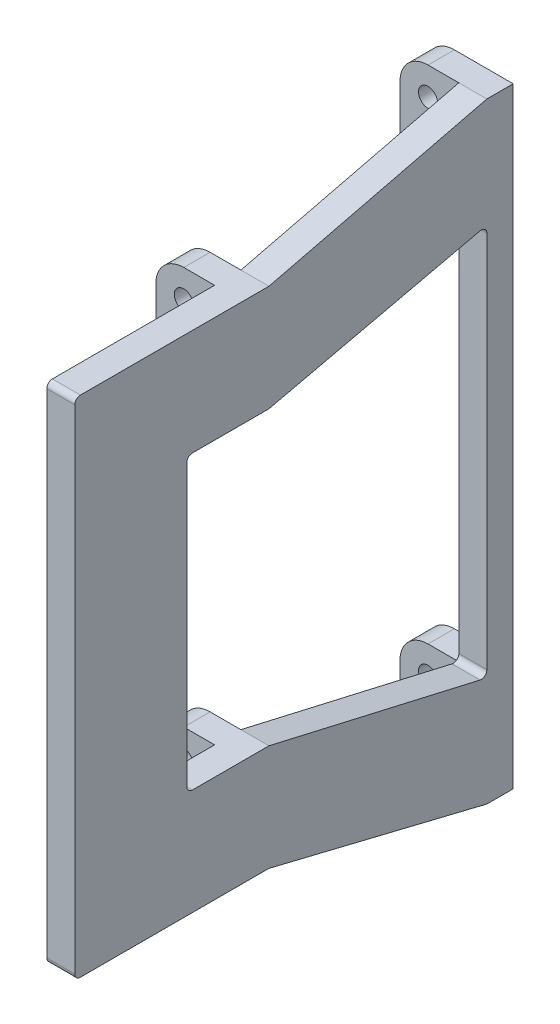
from build123d import *

# Parameters (mm, degrees)
SKETCH_1_W          = 109
SKETCH_1_H          = 78.25
EXTRUDE_1_DEPTH     = 5
CUT_EXTRUDE_1_DEPTH = 5
SKETCH_3_W          = 18.95
SKETCH_3_H          = 4.7
SKETCH_3_W_2        = 19.5
EXTRUDE_2_DEPTH     = 10.5
SKETCH_4_R          = 1.7
CUT_EXTRUDE_2_DEPTH = 5
SKETCH_5_R          = 1.7
CUT_EXTRUDE_3_DEPTH = 5
FILLET_1_R          = 5
FILLET_2_R          = 1
FILLET_3_R          = 1


with BuildPart() as part:
    # 草圖1 → 填料-伸長1 (new body)
    with BuildSketch(Plane.YZ):
        Rectangle(SKETCH_1_W, SKETCH_1_H)
    extrude(amount=EXTRUDE_1_DEPTH)

    # 草圖2 → 除料-伸長1 (cut)
    with BuildSketch(Plane(origin=(0, 0, 0), x_dir=(0, -1, 0), z_dir=(-1, 0, 0))):
        Polygon((-54.5, 39.125), (-54.5, -34.425), (-45, 4.475), (-45, 39.125), align=None)
        Polygon((45, 39.125), (45, 4.475), (54.5, -34.425), (54.5, 39.125), align=None)
        Polygon((-35, -34.425), (35, -34.425), (26.05, 4.475), (26.05, 19.125), (-26.05, 19.125), (-26.05, 4.475), align=None)
    extrude(amount=-CUT_EXTRUDE_1_DEPTH, mode=Mode.SUBTRACT)

    # 草圖3 → 填料-伸長2 (add)
    with BuildSketch(Plane(origin=(0, 0, 0), x_dir=(0, -1, 0), z_dir=(-1, 0, 0))):
        with Locations((-35.525, 6.825)):
            Rectangle(SKETCH_3_W, SKETCH_3_H)
        with Locations((-44.75, -36.775)):
            Rectangle(SKETCH_3_W_2, SKETCH_3_H)
        with Locations((44.75, -36.775)):
            Rectangle(SKETCH_3_W_2, SKETCH_3_H)
        with Locations((35.525, 6.825)):
            Rectangle(SKETCH_3_W, SKETCH_3_H)
    extrude(amount=EXTRUDE_2_DEPTH)

    # 草圖4 → 除料-伸長2 (cut)
    with BuildSketch(Plane(origin=(0, 0, 9.175), x_dir=(0, -1, 0), z_dir=(0, 0, 1))):
        with Locations(Location((-40, -5.5, 0), (0, 0, 90))):
            Circle(SKETCH_4_R)
        with Locations(Location((-31.05, -5.5, 0), (0, 0, 90))):
            Circle(SKETCH_4_R)
        with Locations((31.05, -5.5)):
            Circle(SKETCH_4_R)
        with Locations((40, -5.5)):
            Circle(SKETCH_4_R)
    extrude(amount=-CUT_EXTRUDE_2_DEPTH, mode=Mode.SUBTRACT)

    # 草圖5 → 除料-伸長3 (cut)
    with BuildSketch(Plane(origin=(0, 0, -34.425), x_dir=(0, -1, 0), z_dir=(0, 0, 1))):
        with Locations(Location((-49.5, -5.5, 0), (0, 0, 90))):
            Circle(SKETCH_5_R)
        with Locations(Location((-40, -5.5, 0), (0, 0, 90))):
            Circle(SKETCH_5_R)
        with Locations((40, -5.5)):
            Circle(SKETCH_5_R)
        with Locations(Location((49.5, -5.5, 0), (0, 0, 90))):
            Circle(SKETCH_5_R)
    extrude(amount=-CUT_EXTRUDE_3_DEPTH, mode=Mode.SUBTRACT)

    # 圓角1
    fillet_1_edges = [part.edges().sort_by_distance(p)[0] for p in [
        (-10.5, -45, 6.825),
        (-10.5, -26.05, 6.825),
        (-10.5, -54.5, -36.775),
        (-10.5, -35, -36.775),
        (-10.5, 54.5, -36.775),
        (-10.5, 35, -36.775),
        (-10.5, 45, 6.825),
        (-10.5, 26.05, 6.825),
    ]]
    fillet(fillet_1_edges, radius=FILLET_1_R)

    # 圓角2
    fillet_2_edges = [part.edges().sort_by_distance(p)[0] for p in [
        (2.5, 45, 39.125),
        (2.5, -45, 39.125),
    ]]
    fillet(fillet_2_edges, radius=FILLET_2_R)

    # 圓角3
    # the kernel refuses this fillet: 1 mm, written as the material it adds along each edge
    with BuildSketch(Plane(origin=(0, 35, -34.425), x_dir=(0, -1, 0), z_dir=(1, 0, 0))) as fillet_3_piece_1:
        with BuildLine():
            CenterArc((FILLET_3_R * 1.25620356602, -FILLET_3_R), FILLET_3_R, 90, 102.956961135)
            Line((FILLET_3_R * 0.281664799684, -FILLET_3_R * 1.22421907349), (0, 0))
            Line((0, 0), (FILLET_3_R * 1.25620356602, 0))
        make_face()
    extrude(amount=5)
    with BuildSketch(Plane(origin=(0, 26.05, 19.125), x_dir=(0, -1, 0), z_dir=(1, 0, 0)), Plane(origin=(0, -26.05, 19.125), x_dir=(0, 0, -1), z_dir=(1, 0, 0))) as fillet_3_piece_2:
        with BuildLine():
            CenterArc((FILLET_3_R, FILLET_3_R), FILLET_3_R, 180, 90)
            Line((0, FILLET_3_R), (0, 0))
            Line((0, 0), (FILLET_3_R, 0))
        make_face()
    extrude(amount=5)
    with BuildSketch(Plane(origin=(0, -35, -34.425), x_dir=(0, 1, 0), z_dir=(1, 0, 0))) as fillet_3_piece_3:
        with BuildLine():
            CenterArc((FILLET_3_R * 1.25620356602, FILLET_3_R), FILLET_3_R, 167.043038865, 102.956961135)
            Line((FILLET_3_R * 0.281664799684, FILLET_3_R * 1.22421907349), (0, 0))
            Line((0, 0), (FILLET_3_R * 1.25620356602, 0))
        make_face()
    extrude(amount=5)


solid = part.part
